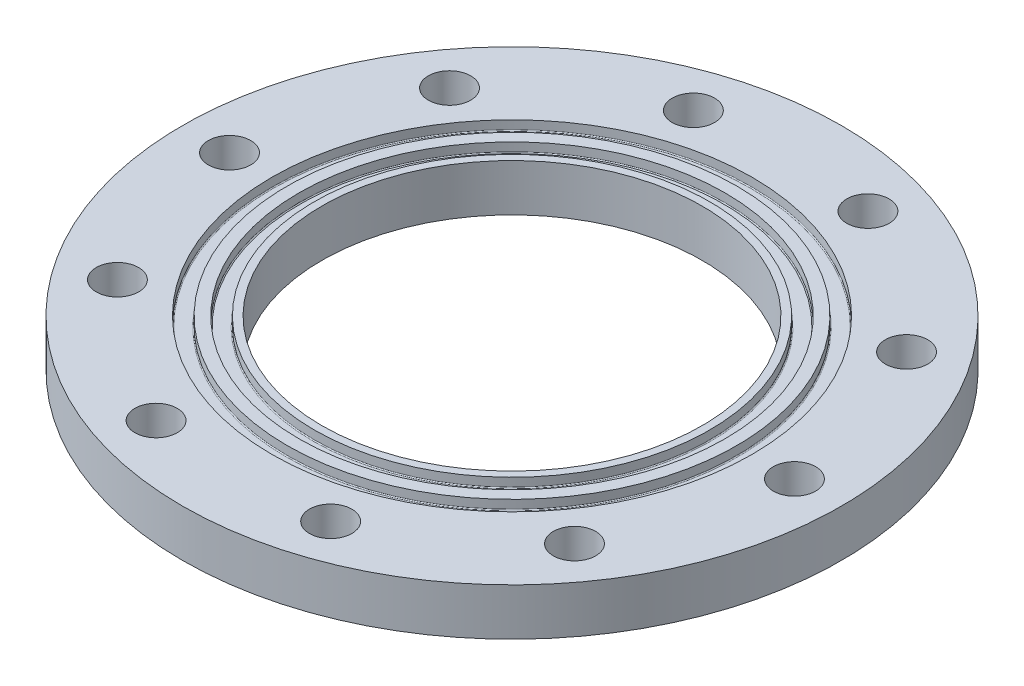
from build123d import *

# Parameters (mm, degrees)
SKETCH1_R           = 70
SKETCH1_R_2         = 40.4
BOSS_EXTRUDE3_DEPTH = 10
SKETCH7_R           = 4.5
CUT_EXTRUDE8_DEPTH  = 100.498743711
CIRPATTERN1_COUNT   = 10
SKETCH9_R           = 51
SKETCH9_R_2         = 47.75
SKETCH9_R_3         = 45.25
SKETCH9_R_4         = 42
CUT_EXTRUDE9_DEPTH  = 2
FILLET1_R           = 0.2


with BuildPart() as part:
    # Sketch1 → Boss-Extrude3 (new body)
    with BuildSketch(Plane(origin=(0, 0, 0), x_dir=(1, 0, 0), z_dir=(0, 1, 0))):
        Circle(SKETCH1_R)
        Circle(SKETCH1_R_2, mode=Mode.SUBTRACT)
    extrude(amount=BOSS_EXTRUDE3_DEPTH)

    # Sketch7 → Cut-Extrude8 (cut, through all)
    with BuildSketch(Plane(origin=(0, 0, 0), x_dir=(1, 0, 0), z_dir=(0, 1, 0))):
        with Locations((-60, 0)):
            Circle(SKETCH7_R)
    cut_extrude8 = extrude(amount=CUT_EXTRUDE8_DEPTH, mode=Mode.SUBTRACT)

    # CirPattern1: Cut-Extrude8 ×10 about axis
    cirpattern1_axis = Axis((0, -6.755914423, 0), (0, 1, 0))
    for i in range(1, CIRPATTERN1_COUNT):
        add(cut_extrude8.rotate(cirpattern1_axis, i * 360 / CIRPATTERN1_COUNT), mode=Mode.SUBTRACT)

    # Sketch9 → Cut-Extrude9 (cut)
    # profile 1 of 2: a face of its own
    with BuildSketch(Plane(origin=(0, 10, 0), x_dir=(1, 0, 0), z_dir=(0, 1, 0))):
        Circle(SKETCH9_R)
        Circle(SKETCH9_R_2, mode=Mode.SUBTRACT)
    # profile 2 of 2: a face of its own
    with BuildSketch(Plane(origin=(0, 10, 0), x_dir=(1, 0, 0), z_dir=(0, 1, 0))):
        Circle(SKETCH9_R_3)
        Circle(SKETCH9_R_4, mode=Mode.SUBTRACT)
    extrude(amount=-CUT_EXTRUDE9_DEPTH, mode=Mode.SUBTRACT)

    # Fillet1
    fillet1_edges = [part.edges().sort_by_distance(p)[0] for p in [
        (-45.25, 8, 0),
        (-42, 8, 0),
        (-51, 8, 0),
        (-47.75, 8, 0),
    ]]
    fillet(fillet1_edges, radius=FILLET1_R)


solid = part.part
